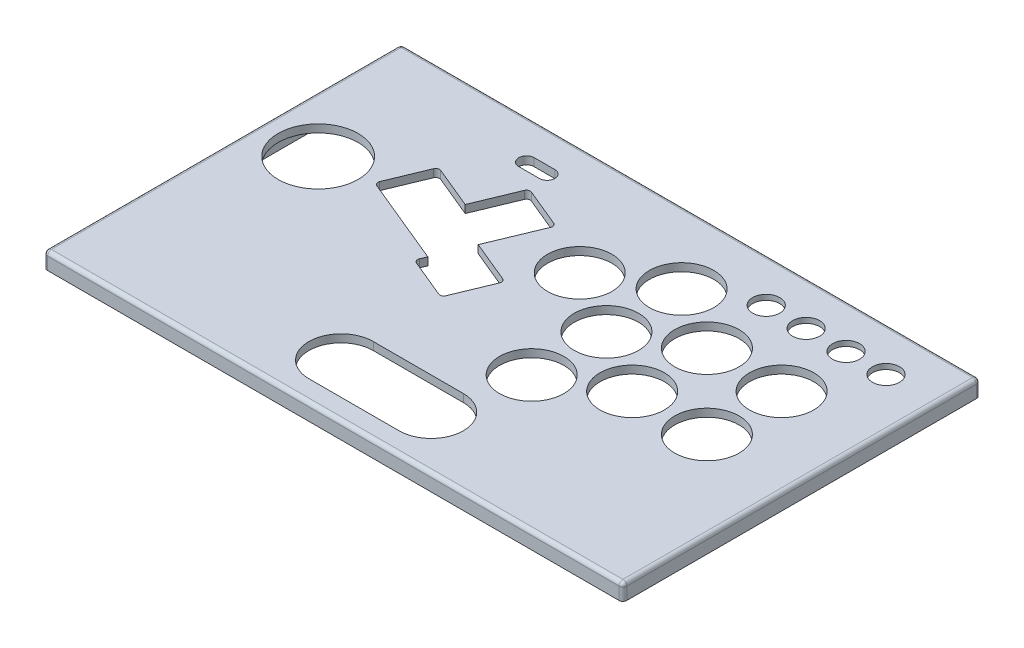
from build123d import *

# Parameters (mm, degrees)
SKETCH2_W                       = 224.807886448
SKETCH2_H                       = 138.699439424
TOP_PLATE_DEPTH                 = 6.35
PRIMARY_BUTTON_CUTOUTS_REACH    = 165.236
BUTTON_CUTOUTS_R                = 12.5
BUTTON_CUTOUTS_R_2              = 15.5
FILLET1_R                       = 1.5
SKETCH4_W                       = 212.807886448
SKETCH4_H                       = 126.699439424
CUT_EXTRUDE2_DEPTH              = 3.3
FILLET2_R                       = 1.5
TAP_DRILL_FOR_M3X0_5_TAP1_D     = 2.5
TAP_DRILL_FOR_M3X0_5_TAP1_DEPTH = 4
TAP_DRILL_FOR_M3X0_5_TAP1_TIP   = 0.751075774
EXTRA_BUTTONS_REACH             = 165.236
SKETCH7_R                       = 5.25
LED_CUTOUT_REACH                = 165.236
CUT_EXTRUDE3_DEPTH              = 1


with BuildPart() as part:
    # Sketch2 → top plate (new body)
    with BuildSketch(Plane(origin=(0, 0, 0), x_dir=(1, 0, 0), z_dir=(0, 1, 0))):
        with Locations((0, 48.849719712)):
            Rectangle(SKETCH2_W, SKETCH2_H)
    extrude(amount=TOP_PLATE_DEPTH)

    # Button Cutouts → primary button cutouts (cut, up to next)
    with BuildSketch(Plane(origin=(0, 0, 0), x_dir=(1, 0, 0), z_dir=(0, 1, 0)), mode=Mode.PRIVATE) as primary_button_cutouts_sk1:
        with Locations((24.5, 32)):
            Circle(BUTTON_CUTOUTS_R)
    primary_button_cutouts_tool1 = extrude(primary_button_cutouts_sk1.sketch, amount=PRIMARY_BUTTON_CUTOUTS_REACH, mode=Mode.PRIVATE) & part.part
    # Button Cutouts → primary button cutouts (cut, up to next)
    with BuildSketch(Plane(origin=(0, 0, 0), x_dir=(1, 0, 0), z_dir=(0, 1, 0)), mode=Mode.PRIVATE) as primary_button_cutouts_sk2:
        with Locations((24.5, 61)):
            Circle(BUTTON_CUTOUTS_R)
    primary_button_cutouts_tool2 = extrude(primary_button_cutouts_sk2.sketch, amount=PRIMARY_BUTTON_CUTOUTS_REACH, mode=Mode.PRIVATE) & part.part
    # Button Cutouts → primary button cutouts (cut, up to next)
    with BuildSketch(Plane(origin=(0, 0, 0), x_dir=(1, 0, 0), z_dir=(0, 1, 0)), mode=Mode.PRIVATE) as primary_button_cutouts_sk3:
        with Locations((49.5, 46)):
            Circle(BUTTON_CUTOUTS_R)
    primary_button_cutouts_tool3 = extrude(primary_button_cutouts_sk3.sketch, amount=PRIMARY_BUTTON_CUTOUTS_REACH, mode=Mode.PRIVATE) & part.part
    # Button Cutouts → primary button cutouts (cut, up to next)
    with BuildSketch(Plane(origin=(0, 0, 0), x_dir=(1, 0, 0), z_dir=(0, 1, 0)), mode=Mode.PRIVATE) as primary_button_cutouts_sk4:
        with Locations((49.5, 75)):
            Circle(BUTTON_CUTOUTS_R)
    primary_button_cutouts_tool4 = extrude(primary_button_cutouts_sk4.sketch, amount=PRIMARY_BUTTON_CUTOUTS_REACH, mode=Mode.PRIVATE) & part.part
    # Button Cutouts → primary button cutouts (cut, up to next)
    with BuildSketch(Plane(origin=(0, 0, 0), x_dir=(1, 0, 0), z_dir=(0, 1, 0)), mode=Mode.PRIVATE) as primary_button_cutouts_sk5:
        with Locations((78.5, 75)):
            Circle(BUTTON_CUTOUTS_R)
    primary_button_cutouts_tool5 = extrude(primary_button_cutouts_sk5.sketch, amount=PRIMARY_BUTTON_CUTOUTS_REACH, mode=Mode.PRIVATE) & part.part
    # Button Cutouts → primary button cutouts (cut, up to next)
    with BuildSketch(Plane(origin=(0, 0, 0), x_dir=(1, 0, 0), z_dir=(0, 1, 0)), mode=Mode.PRIVATE) as primary_button_cutouts_sk6:
        with Locations((78.5, 46)):
            Circle(BUTTON_CUTOUTS_R)
    primary_button_cutouts_tool6 = extrude(primary_button_cutouts_sk6.sketch, amount=PRIMARY_BUTTON_CUTOUTS_REACH, mode=Mode.PRIVATE) & part.part
    # Button Cutouts → primary button cutouts (cut, up to next)
    with BuildSketch(Plane(origin=(0, 0, 0), x_dir=(1, 0, 0), z_dir=(0, 1, 0)), mode=Mode.PRIVATE) as primary_button_cutouts_sk7:
        with Locations((-90.403943224, 64.008304483)):
            Circle(BUTTON_CUTOUTS_R_2)
    primary_button_cutouts_tool7 = extrude(primary_button_cutouts_sk7.sketch, amount=PRIMARY_BUTTON_CUTOUTS_REACH, mode=Mode.PRIVATE) & part.part
    # Button Cutouts → primary button cutouts (cut, up to next)
    with BuildSketch(Plane(origin=(0, 0, 0), x_dir=(1, 0, 0), z_dir=(0, 1, 0)), mode=Mode.PRIVATE) as primary_button_cutouts_sk8:
        with Locations((24.680313923, 89.999439424)):
            Circle(BUTTON_CUTOUTS_R)
    primary_button_cutouts_tool8 = extrude(primary_button_cutouts_sk8.sketch, amount=PRIMARY_BUTTON_CUTOUTS_REACH, mode=Mode.PRIVATE) & part.part
    # Button Cutouts → primary button cutouts (cut, up to next)
    with BuildSketch(Plane(origin=(0, 0, 0), x_dir=(1, 0, 0), z_dir=(0, 1, 0)), mode=Mode.PRIVATE) as primary_button_cutouts_sk9:
        with Locations((-0.524094275, 75.65587615)):
            Circle(BUTTON_CUTOUTS_R)
    primary_button_cutouts_tool9 = extrude(primary_button_cutouts_sk9.sketch, amount=PRIMARY_BUTTON_CUTOUTS_REACH, mode=Mode.PRIVATE) & part.part
    # Button Cutouts → primary button cutouts (cut, up to next)
    with BuildSketch(Plane(origin=(0, 0, 0), x_dir=(1, 0, 0), z_dir=(0, 1, 0)), mode=Mode.PRIVATE) as primary_button_cutouts_sk10:
        with BuildLine():
            Line((17.5, -12.5), (-17.5, -12.5))
            ThreePointArc((-17.5, -12.5), (-30, 0), (-17.5, 12.5))
            Line((-17.5, 12.5), (17.5, 12.5))
            ThreePointArc((17.5, 12.5), (30, 0), (17.5, -12.5))
        make_face()
    primary_button_cutouts_tool10 = extrude(primary_button_cutouts_sk10.sketch, amount=PRIMARY_BUTTON_CUTOUTS_REACH, mode=Mode.PRIVATE) & part.part
    # Button Cutouts → primary button cutouts (cut, up to next)
    with BuildSketch(Plane(origin=(0, 0, 0), x_dir=(1, 0, 0), z_dir=(0, 1, 0)), mode=Mode.PRIVATE) as primary_button_cutouts_sk11:
        Polygon((-70.581424626, 66.134393952), (-63.310439411, 83.688105069), (-45.710534316, 76.397985683), (-38.42041493, 93.997890777), (-20.866703812, 86.726905562), (-29.687556928, 65.431482338), (-12.087651834, 58.141362951), (-19.358637049, 40.587651834), (-36.912348166, 47.858637049), (-35.381614437, 51.554155179), align=None)
    primary_button_cutouts_tool11 = extrude(primary_button_cutouts_sk11.sketch, amount=PRIMARY_BUTTON_CUTOUTS_REACH, mode=Mode.PRIVATE) & part.part
    add(primary_button_cutouts_tool1.solids().sort_by_distance((24.5, 0, -32))[0], mode=Mode.SUBTRACT)
    add(primary_button_cutouts_tool2.solids().sort_by_distance((24.5, 0, -61))[0], mode=Mode.SUBTRACT)
    add(primary_button_cutouts_tool3.solids().sort_by_distance((49.5, 0, -46))[0], mode=Mode.SUBTRACT)
    add(primary_button_cutouts_tool4.solids().sort_by_distance((49.5, 0, -75))[0], mode=Mode.SUBTRACT)
    add(primary_button_cutouts_tool5.solids().sort_by_distance((78.5, 0, -75))[0], mode=Mode.SUBTRACT)
    add(primary_button_cutouts_tool6.solids().sort_by_distance((78.5, 0, -46))[0], mode=Mode.SUBTRACT)
    add(primary_button_cutouts_tool7.solids().sort_by_distance((-90.403943, 0, -64.008304))[0], mode=Mode.SUBTRACT)
    add(primary_button_cutouts_tool8.solids().sort_by_distance((24.680314, 0, -89.999439))[0], mode=Mode.SUBTRACT)
    add(primary_button_cutouts_tool9.solids().sort_by_distance((-0.524094, 0, -75.655876))[0], mode=Mode.SUBTRACT)
    add(primary_button_cutouts_tool10.solids().sort_by_distance((0, 0, 0))[0], mode=Mode.SUBTRACT)
    add(primary_button_cutouts_tool11.solids().sort_by_distance((-39.131182, 0, -67.460691))[0], mode=Mode.SUBTRACT)

    # Fillet1
    fillet1_edges = [part.edges().sort_by_distance(p)[0] for p in [
        (-20.866703812, 3.175, -86.726905562),
        (-12.087651834, 3.175, -58.141362951),
        (-19.358637049, 3.175, -40.587651834),
        (-36.912348166, 3.175, -47.858637049),
        (-70.581424626, 3.175, -66.134393952),
        (-63.310439411, 3.175, -83.688105069),
        (-38.42041493, 3.175, -93.997890777),
    ]]
    fillet(fillet1_edges, radius=FILLET1_R)

    # Sketch4 → Cut-Extrude2 (cut)
    with BuildSketch(Plane.XZ):
        with Locations((0, -48.849719712)):
            Rectangle(SKETCH4_W, SKETCH4_H)
    extrude(amount=-CUT_EXTRUDE2_DEPTH, mode=Mode.SUBTRACT)

    # Fillet2
    fillet2_edges = [part.edges().sort_by_distance(p)[0] for p in [
        (112.403943224, 3.175, -118.199439424),
        (-112.403943224, 3.175, -118.199439424),
        (-112.403943224, 3.175, 20.5),
        (112.403943224, 3.175, 20.5),
        (112.403943224, 6.35, -48.849719712),
        (0, 6.35, -118.199439424),
        (0, 6.35, 20.5),
        (-112.403943224, 6.35, -48.849719712),
    ]]
    fillet(fillet2_edges, radius=FILLET2_R)

    # Tap Drill for M3x0.5 Tap1
    with Locations(Plane(origin=(-108.403943224, 0, 16.5), x_dir=(0, 0, -1), z_dir=(0, -1, 0))):
        with Locations((0, 0), (130.699439424, 0), (130.699439424, 216.807886448), (0, 216.807886448)):
            Hole(TAP_DRILL_FOR_M3X0_5_TAP1_D / 2, depth=TAP_DRILL_FOR_M3X0_5_TAP1_DEPTH)
            with Locations((0, 0, -(TAP_DRILL_FOR_M3X0_5_TAP1_DEPTH + TAP_DRILL_FOR_M3X0_5_TAP1_TIP / 2))):  # 118° drill point
                Cone(0, TAP_DRILL_FOR_M3X0_5_TAP1_D / 2, TAP_DRILL_FOR_M3X0_5_TAP1_TIP, mode=Mode.SUBTRACT)

    # Sketch7 → extra_buttons (cut, up to next)
    with BuildSketch(Plane(origin=(0, 6.35, 0), x_dir=(1, 0, 0), z_dir=(0, 1, 0)), mode=Mode.PRIVATE) as extra_buttons_sk1:
        with Locations((46.596056776, 100.920000483)):
            Circle(SKETCH7_R)
    extra_buttons_tool1 = extrude(extra_buttons_sk1.sketch, amount=-EXTRA_BUTTONS_REACH, mode=Mode.PRIVATE) & part.part
    # Sketch7 → extra_buttons (cut, up to next)
    with BuildSketch(Plane(origin=(0, 6.35, 0), x_dir=(1, 0, 0), z_dir=(0, 1, 0)), mode=Mode.PRIVATE) as extra_buttons_sk2:
        with Locations((62.096056776, 100.920000483)):
            Circle(SKETCH7_R)
    extra_buttons_tool2 = extrude(extra_buttons_sk2.sketch, amount=-EXTRA_BUTTONS_REACH, mode=Mode.PRIVATE) & part.part
    # Sketch7 → extra_buttons (cut, up to next)
    with BuildSketch(Plane(origin=(0, 6.35, 0), x_dir=(1, 0, 0), z_dir=(0, 1, 0)), mode=Mode.PRIVATE) as extra_buttons_sk3:
        with Locations((77.596056776, 100.920000483)):
            Circle(SKETCH7_R)
    extra_buttons_tool3 = extrude(extra_buttons_sk3.sketch, amount=-EXTRA_BUTTONS_REACH, mode=Mode.PRIVATE) & part.part
    # Sketch7 → extra_buttons (cut, up to next)
    with BuildSketch(Plane(origin=(0, 6.35, 0), x_dir=(1, 0, 0), z_dir=(0, 1, 0)), mode=Mode.PRIVATE) as extra_buttons_sk4:
        with Locations((93.096056776, 100.920000483)):
            Circle(SKETCH7_R)
    extra_buttons_tool4 = extrude(extra_buttons_sk4.sketch, amount=-EXTRA_BUTTONS_REACH, mode=Mode.PRIVATE) & part.part
    add(extra_buttons_tool1.solids().sort_by_distance((46.596057, 6.35, -100.92))[0], mode=Mode.SUBTRACT)
    add(extra_buttons_tool2.solids().sort_by_distance((62.096057, 6.35, -100.92))[0], mode=Mode.SUBTRACT)
    add(extra_buttons_tool3.solids().sort_by_distance((77.596057, 6.35, -100.92))[0], mode=Mode.SUBTRACT)
    add(extra_buttons_tool4.solids().sort_by_distance((93.096057, 6.35, -100.92))[0], mode=Mode.SUBTRACT)

    # Sketch8 → led_cutout (cut, up to next)
    with BuildSketch(Plane(origin=(0, 6.35, 0), x_dir=(1, 0, 0), z_dir=(0, 1, 0)), mode=Mode.PRIVATE) as led_cutout_sk1:
        with BuildLine():
            Line((-48.062495753, 105.533619334), (-40.062495753, 105.533619334))
            ThreePointArc((-40.062495753, 105.533619334), (-37.062495753, 102.533619334), (-40.062495753, 99.533619334))
            Line((-40.062495753, 99.533619334), (-48.062495753, 99.533619334))
            ThreePointArc((-48.062495753, 99.533619334), (-51.062495753, 102.533619334), (-48.062495753, 105.533619334))
        make_face()
    led_cutout_tool1 = extrude(led_cutout_sk1.sketch, amount=-LED_CUTOUT_REACH, mode=Mode.PRIVATE) & part.part
    add(led_cutout_tool1.solids().sort_by_distance((-44.062496, 6.35, -102.533619))[0], mode=Mode.SUBTRACT)

    # Sketch9 → Cut-Extrude3 (cut)
    with BuildSketch(Plane(origin=(0, 3.3, 0), x_dir=(-1, 0, 0), z_dir=(0, -1, 0))):
        with BuildLine():
            Line((-93.096056776, 110.920000483), (-46.596056776, 110.920000483))
            ThreePointArc((-46.596056776, 110.920000483), (-36.596056776, 100.920000483), (-46.596056776, 90.920000483))
            Line((-46.596056776, 90.920000483), (-93.096056776, 90.920000483))
            ThreePointArc((-93.096056776, 90.920000483), (-103.096056776, 100.920000483), (-93.096056776, 110.920000483))
        make_face()
    extrude(amount=-CUT_EXTRUDE3_DEPTH, mode=Mode.SUBTRACT)


solid = part.part
